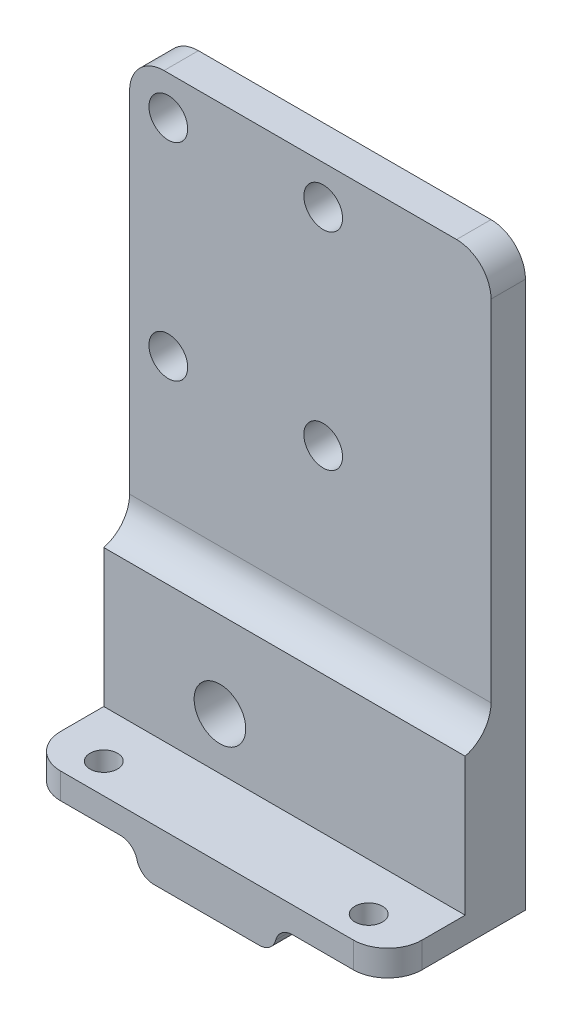
from build123d import *

# Parameters (mm, degrees)
SKETCH1_W           = 42
SKETCH1_H           = 67.5
SKETCH1_R           = 3
SKETCH1_R_2         = 2.25
BOSS_EXTRUDE1_DEPTH = 4
SKETCH2_W           = 42
SKETCH2_H           = 3
BOSS_EXTRUDE2_DEPTH = 12
SKETCH3_W           = 42
SKETCH3_H           = 16
SKETCH3_R           = 3
BOSS_EXTRUDE3_DEPTH = 3
CUT_EXTRUDE1_REACH  = 74.479
SKETCH4_R           = 1.6
FILLET1_R           = 4
SKETCH5_W           = 16
SKETCH5_H           = 16
BOSS_EXTRUDE4_DEPTH = 3
FILLET3_R           = 2
FILLET4_R           = 2


with BuildPart() as part:
    # Sketch1 → Boss-Extrude1 (new body)
    with BuildSketch(Plane.XY):
        Rectangle(SKETCH1_W, SKETCH1_H)
        with Locations((-7.5, -24.75)):
            Circle(SKETCH1_R, mode=Mode.SUBTRACT)
        with Locations((1.5, 29.25)):
            Circle(SKETCH1_R_2, mode=Mode.SUBTRACT)
        with Locations((-16.5, 29.25)):
            Circle(SKETCH1_R_2, mode=Mode.SUBTRACT)
        with Locations((1.5, 5.25)):
            Circle(SKETCH1_R_2, mode=Mode.SUBTRACT)
        with Locations((-16.5, 5.25)):
            Circle(SKETCH1_R_2, mode=Mode.SUBTRACT)
    extrude(amount=BOSS_EXTRUDE1_DEPTH)

    # Sketch2 → Boss-Extrude2 (add)
    with BuildSketch(Plane.XY.offset(4)):
        with Locations((0, -32.25)):
            Rectangle(SKETCH2_W, SKETCH2_H)
    extrude(amount=BOSS_EXTRUDE2_DEPTH)

    # Sketch3 → Boss-Extrude3 (add)
    with BuildSketch(Plane.XY.offset(4)):
        with Locations((0, -22.75)):
            Rectangle(SKETCH3_W, SKETCH3_H)
        with Locations((-7.5, -24.75)):
            Circle(SKETCH3_R, mode=Mode.SUBTRACT)
    extrude(amount=BOSS_EXTRUDE3_DEPTH)

    # Sketch4 → Cut-Extrude1 (cut, up to next)
    with BuildSketch(Plane.XZ.offset(33.75), mode=Mode.PRIVATE) as cut_extrude1_sk1:
        with Locations(Location((-15.5, 12.5, 0), (0, 0, 270))):
            Circle(SKETCH4_R)
    cut_extrude1_tool1 = extrude(cut_extrude1_sk1.sketch, amount=-CUT_EXTRUDE1_REACH, mode=Mode.PRIVATE) & part.part
    # Sketch4 → Cut-Extrude1 (cut, up to next)
    with BuildSketch(Plane.XZ.offset(33.75), mode=Mode.PRIVATE) as cut_extrude1_sk2:
        with Locations(Location((15.285724533, 12.5, 0), (0, 0, 270))):
            Circle(SKETCH4_R)
    cut_extrude1_tool2 = extrude(cut_extrude1_sk2.sketch, amount=-CUT_EXTRUDE1_REACH, mode=Mode.PRIVATE) & part.part
    add(cut_extrude1_tool1.solids().sort_by_distance((-15.5, -33.75, 12.5))[0], mode=Mode.SUBTRACT)
    add(cut_extrude1_tool2.solids().sort_by_distance((15.285725, -33.75, 12.5))[0], mode=Mode.SUBTRACT)

    # Fillet1
    # the kernel refuses this fillet: 4 mm, written as the material it adds along each edge
    with BuildSketch(Plane(origin=(-21, -14.75, 4), x_dir=(0, 1, 0), z_dir=(1, 0, 0))) as fillet1_piece_1:
        with BuildLine():
            CenterArc((3.872983346, 4), FILLET1_R, 194.477512186, 75.522487814)
            Line((0, 3), (0, 0))
            Line((0, 0), (3.872983346, 0))
        make_face()
    extrude(amount=42)
    # the kernel refuses this fillet: 4 mm, written as the material it takes off along each edge
    with BuildSketch(Plane(origin=(21, -20.75, 16), x_dir=(0, 0, -1), z_dir=(0, -1, 0)), Plane(origin=(-21, -43.75, 16), x_dir=(0, 0, -1), z_dir=(0, 1, 0))) as fillet1_2_piece_1:
        with BuildLine():
            CenterArc((FILLET1_R, -FILLET1_R), FILLET1_R, 90, 90)
            Line((0, -FILLET1_R), (0, 0))
            Line((0, 0), (FILLET1_R, 0))
        make_face()
    extrude(amount=23, mode=Mode.SUBTRACT)
    with BuildSketch(Plane(origin=(21, 33.75, -10), x_dir=(-1, 0, 0), z_dir=(0, 0, 1))) as fillet1_2_piece_2:
        with BuildLine():
            CenterArc((FILLET1_R, FILLET1_R), FILLET1_R, 180, 90)
            Line((0, FILLET1_R), (0, 0))
            Line((0, 0), (FILLET1_R, 0))
        make_face()
    extrude(amount=24, mode=Mode.SUBTRACT)
    with BuildSketch(Plane(origin=(-21, 33.75, -10), x_dir=(1, 0, 0), z_dir=(0, 0, 1))) as fillet1_2_piece_3:
        with BuildLine():
            CenterArc((FILLET1_R, -FILLET1_R), FILLET1_R, 90, 90)
            Line((0, -FILLET1_R), (0, 0))
            Line((0, 0), (FILLET1_R, 0))
        make_face()
    extrude(amount=24, mode=Mode.SUBTRACT)

    # Sketch5 → Boss-Extrude4 (add)
    with BuildSketch(Plane.XZ.offset(33.75)):
        with Locations((-0.071835854, 8)):
            Rectangle(SKETCH5_W, SKETCH5_H)
    extrude(amount=BOSS_EXTRUDE4_DEPTH)

    # Fillet3
    fillet3_edges = [part.edges().sort_by_distance(p)[0] for p in [
        (-8.071835854, -33.75, 8),
        (7.928164146, -33.75, 8),
    ]]
    fillet(fillet3_edges, radius=FILLET3_R)

    # Fillet4
    fillet4_edges = [part.edges().sort_by_distance(p)[0] for p in [
        (7.928164146, -36.75, 8),
        (-8.071835854, -36.75, 8),
    ]]
    fillet(fillet4_edges, radius=FILLET4_R)


solid = part.part
